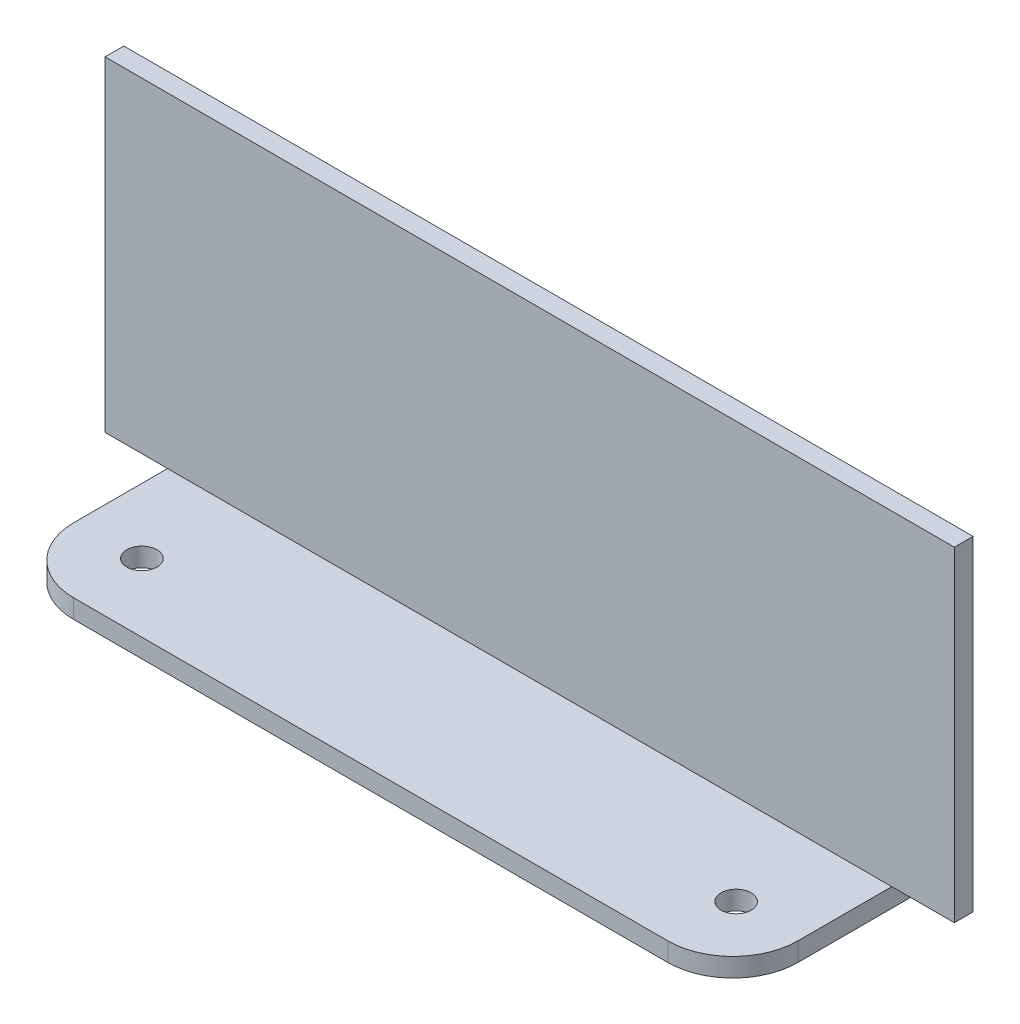
from build123d import *

# Parameters (mm, degrees)
SKETCH1_R           = 2.41
BOSS_EXTRUDE1_DEPTH = 3
SKETCH1_4_W         = 115.78
SKETCH1_4_H         = 3
BOSS_EXTRUDE2_DEPTH = 55
SKETCH3_W           = 3
SKETCH3_H           = 52
BOSS_EXTRUDE3_DEPTH = 10
SKETCH2_W           = 3
SKETCH2_H           = 52
BOSS_EXTRUDE4_DEPTH = 10


with BuildPart() as part:
    # Sketch1 → Boss-Extrude1 (new body)
    with BuildSketch(Plane(origin=(0, 0, 0), x_dir=(1, 0, 0), z_dir=(0, 1, 0))):
        with BuildLine():
            ThreePointArc((0, 10.39), (3.043160543, 3.043160543), (10.39, 0))
            Line((10.39, 0), (105.39, 0))
            ThreePointArc((105.39, 0), (112.736839457, 3.043160543), (115.78, 10.39))
            Line((115.78, 10.39), (115.78, 28.41))
            Line((115.78, 28.41), (0, 28.41))
            Line((0, 28.41), (0, 10.39))
        make_face()
        with Locations((10.39, 10.91)):
            Circle(SKETCH1_R, mode=Mode.SUBTRACT)
        with Locations((105.39, 10.91)):
            Circle(SKETCH1_R, mode=Mode.SUBTRACT)
    extrude(amount=BOSS_EXTRUDE1_DEPTH)

    # Sketch1<4> → Boss-Extrude2 (add)
    with BuildSketch(Plane(origin=(0, 0, 0), x_dir=(1, 0, 0), z_dir=(0, 1, 0))):
        with Locations((57.89, 26.91)):
            Rectangle(SKETCH1_4_W, SKETCH1_4_H)
    extrude(amount=BOSS_EXTRUDE2_DEPTH)

    # Sketch3 → Boss-Extrude3 (add)
    with BuildSketch(Plane.ZY):
        with Locations((-26.91, 29)):
            Rectangle(SKETCH3_W, SKETCH3_H)
    extrude(amount=BOSS_EXTRUDE3_DEPTH)

    # Sketch2 → Boss-Extrude4 (add)
    with BuildSketch(Plane(origin=(115.78, 0, 0), x_dir=(0, 0, -1), z_dir=(1, 0, 0))):
        with Locations((26.91, 29)):
            Rectangle(SKETCH2_W, SKETCH2_H)
    extrude(amount=BOSS_EXTRUDE4_DEPTH)


solid = part.part
